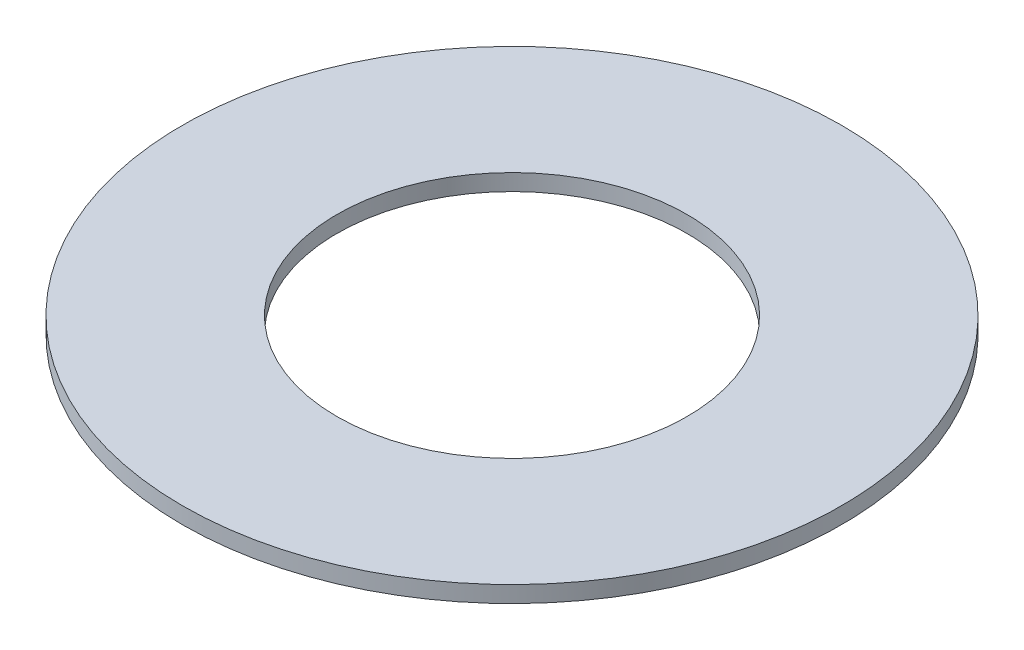
from build123d import *

# Parameters (mm, degrees)
SKETCH1_R           = 80
BOSS_EXTRUDE1_DEPTH = 4
SKETCH2_R           = 42.5
CUT_EXTRUDE1_DEPTH  = 114.207773585


with BuildPart() as part:
    # Sketch1 → Boss-Extrude1 (new body)
    with BuildSketch(Plane(origin=(0, 0, 0), x_dir=(1, 0, 0), z_dir=(0, 1, 0))):
        Circle(SKETCH1_R)
    extrude(amount=BOSS_EXTRUDE1_DEPTH)

    # Sketch2 → Cut-Extrude1 (cut, through all)
    with BuildSketch(Plane(origin=(0, 0, 0), x_dir=(1, 0, 0), z_dir=(0, 1, 0))):
        Circle(SKETCH2_R)
    extrude(amount=CUT_EXTRUDE1_DEPTH, mode=Mode.SUBTRACT)


solid = part.part
